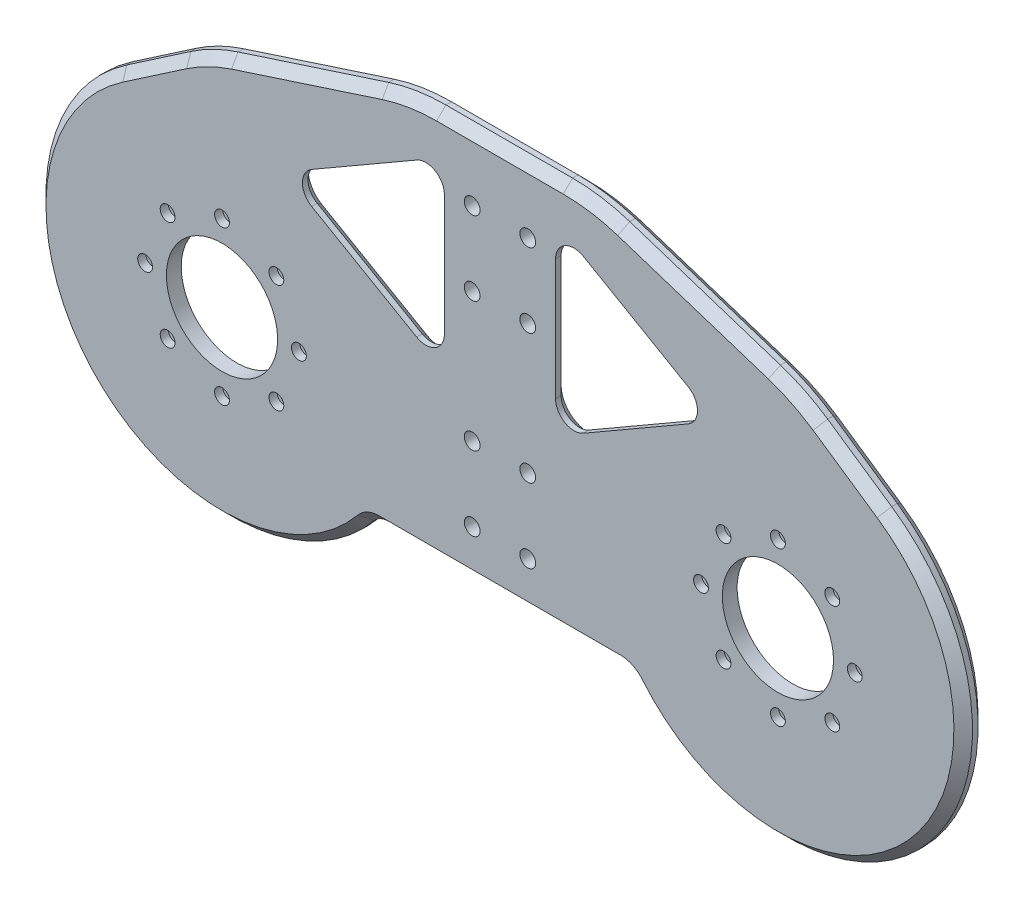
from build123d import *
from build123d.topology import SkipClean

# Parameters (mm, degrees)
SKETCH_1_R               = 30
EXTRUDE_1_DEPTH          = 8
CUT_EXTRUDE_5_DEPTH      = 905.685953271
CUT_EXTRUDE_5_DEPTH_BACK = 905.685953271
SKETCH_8_R               = 2.25
SKETCH_9_R               = 4
CUT_EXTRUDE_6_DEPTH      = 4.4
FILLET_1_R               = 100
CUT_EXTRUDE_7_DEPTH      = 83
CUT_EXTRUDE_8_DEPTH      = 83
FILLET_3_R               = 100
FILLET_4_R               = 10
SKETCH_14_R              = 4.25
CUT_EXTRUDE_9_DEPTH      = 83
EXTRUDE_2_DEPTH          = 5
CUT_EXTRUDE_10_DEPTH     = 69
FILLET_5_R               = 10
CHAMFER_1_SIZE           = 5
CHAMFER_2_SIZE           = 5


with BuildPart() as part:
    # 草图1 → 凸台-拉伸1 (new body)
    with BuildSketch(Plane.XY):
        Polygon((0, 250), (769.420884294, 0), (0, 0), (-100, 0), (-869.420884294, 0), (-100, 250), align=None)
        with Locations((100, 100)):
            Circle(SKETCH_1_R, mode=Mode.SUBTRACT)
        with Locations(Location((-200, 100, 0), (0, 0, 180))):
            Circle(SKETCH_1_R, mode=Mode.SUBTRACT)
    extrude(amount=EXTRUDE_1_DEPTH)

    # 草图8 → 切除-拉伸5 (cut, two sides: drawn at the far end of the back side and taken through both)
    with BuildSketch(Plane.XY.offset(8).offset(-CUT_EXTRUDE_5_DEPTH_BACK)):
        with Locations((100, 141.5)):
            Circle(SKETCH_8_R)
        with Locations((129.344931419, 129.344931419)):
            Circle(SKETCH_8_R)
        with Locations((141.5, 100)):
            Circle(SKETCH_8_R)
        with Locations((129.344931419, 70.655068581)):
            Circle(SKETCH_8_R)
        with Locations((100, 58.5)):
            Circle(SKETCH_8_R)
        with Locations((70.655068581, 70.655068581)):
            Circle(SKETCH_8_R)
        with Locations((58.5, 100)):
            Circle(SKETCH_8_R)
        with Locations((70.655068581, 129.344931419)):
            Circle(SKETCH_8_R)
        with Locations(Location((-170.655068581, 129.344931419, 0), (0, 0, 180))):
            Circle(SKETCH_8_R)
        with Locations(Location((-158.5, 100, 0), (0, 0, 180))):
            Circle(SKETCH_8_R)
        with Locations(Location((-170.655068581, 70.655068581, 0), (0, 0, 180))):
            Circle(SKETCH_8_R)
        with Locations(Location((-200, 58.5, 0), (0, 0, 180))):
            Circle(SKETCH_8_R)
        with Locations(Location((-229.344931419, 70.655068581, 0), (0, 0, 180))):
            Circle(SKETCH_8_R)
        with Locations(Location((-241.5, 100, 0), (0, 0, 180))):
            Circle(SKETCH_8_R)
        with Locations(Location((-229.344931419, 129.344931419, 0), (0, 0, 180))):
            Circle(SKETCH_8_R)
        with Locations(Location((-200, 141.5, 0), (0, 0, 180))):
            Circle(SKETCH_8_R)
    extrude(amount=CUT_EXTRUDE_5_DEPTH + CUT_EXTRUDE_5_DEPTH_BACK, mode=Mode.SUBTRACT)

    # 草图9 → 切除-拉伸6 (cut)
    with BuildSketch(Plane.XY.offset(8)):
        with Locations((-200, 141.5)):
            Circle(SKETCH_9_R)
        with Locations((-170.655068581, 129.344931419)):
            Circle(SKETCH_9_R)
        with Locations((-158.5, 100)):
            Circle(SKETCH_9_R)
        with Locations((-170.655068581, 70.655068581)):
            Circle(SKETCH_9_R)
        with Locations((-200, 58.5)):
            Circle(SKETCH_9_R)
        with Locations((-229.344931419, 70.655068581)):
            Circle(SKETCH_9_R)
        with Locations((-241.5, 100)):
            Circle(SKETCH_9_R)
        with Locations((-229.344931419, 129.344931419)):
            Circle(SKETCH_9_R)
        with Locations(Location((129.344931419, 129.344931419, 0), (0, 0, 180))):
            Circle(SKETCH_9_R)
        with Locations(Location((141.5, 100, 0), (0, 0, 180))):
            Circle(SKETCH_9_R)
        with Locations(Location((129.344931419, 70.655068581, 0), (0, 0, 180))):
            Circle(SKETCH_9_R)
        with Locations(Location((100, 58.5, 0), (0, 0, 180))):
            Circle(SKETCH_9_R)
        with Locations(Location((70.655068581, 70.655068581, 0), (0, 0, 180))):
            Circle(SKETCH_9_R)
        with Locations(Location((58.5, 100, 0), (0, 0, 180))):
            Circle(SKETCH_9_R)
        with Locations(Location((70.655068581, 129.344931419, 0), (0, 0, 180))):
            Circle(SKETCH_9_R)
        with Locations(Location((100, 141.5, 0), (0, 0, 180))):
            Circle(SKETCH_9_R)
    extrude(amount=-CUT_EXTRUDE_6_DEPTH, mode=Mode.SUBTRACT)

    # 圆角1
    fillet_1_edges = [part.edges().sort_by_distance(p)[0] for p in [
        (-869.420884294, 0, 4),
        (769.420884294, 0, 4),
    ]]
    fillet(fillet_1_edges, radius=FILLET_1_R)

    # 草图12 → 切除-拉伸7 (cut)
    with BuildSketch(Plane(origin=(0, 0, 0), x_dir=(-1, 0, 0), z_dir=(0, 0, -1))):
        with BuildLine():
            Line((-20, 40), (120, 40))
            ThreePointArc((120, 40), (155.27864045, 10.5572809), (200, 0))
            Line((200, 0), (-100, 0))
            ThreePointArc((-100, 0), (-55.27864045, 10.5572809), (-20, 40))
        make_face()
    extrude(amount=-CUT_EXTRUDE_7_DEPTH, mode=Mode.SUBTRACT)

    # 草图13 → 切除-拉伸8 (cut)
    with BuildSketch(Plane.XY.offset(8)):
        with BuildLine():
            Line((-238.045732826, 0), (-200, 0))
            ThreePointArc((-200, 0), (-295.54722537, 70.491904093), (-256.388333797, 182.585445519))
            Line((-256.388333797, 182.585445519), (-210, 214.258833414))
            Line((-210, 214.258833414), (-268.947432264, 195.10565163))
            ThreePointArc((-268.947432264, 195.10565163), (-336.814566886, 84.356553496), (-238.045732826, 0))
        make_face()
        with BuildLine():
            Line((110, 214.258833414), (168.947432264, 195.10565163))
            ThreePointArc((168.947432264, 195.10565163), (236.814566886, 84.356553496), (138.045732826, 0))
            Line((138.045732826, 0), (100, 0))
            ThreePointArc((100, 0), (195.54722537, 70.491904093), (156.388333797, 182.585445519))
            Line((156.388333797, 182.585445519), (110, 214.258833414))
        make_face()
    extrude(amount=-CUT_EXTRUDE_8_DEPTH, mode=Mode.SUBTRACT)

    # 圆角3
    fillet_3_edges = [part.edges().sort_by_distance(p)[0] for p in [
        (-100, 250, 4),
        (0, 250, 4),
        (-210, 214.258833414, 4),
        (110, 214.258833414, 4),
    ]]
    fillet(fillet_3_edges, radius=FILLET_3_R)

    # 圆角4
    fillet_4_edges = [part.edges().sort_by_distance(p)[0] for p in [
        (20, 40, 4),
        (-120, 40, 4),
    ]]
    fillet(fillet_4_edges, radius=FILLET_4_R)

    # 草图14 → 切除-拉伸9 (cut)
    with BuildSketch(Plane.XY.offset(8)):
        with Locations((-35, 65)):
            Circle(SKETCH_14_R)
        with Locations((-35, 105)):
            Circle(SKETCH_14_R)
        with Locations((-35, 175)):
            Circle(SKETCH_14_R)
        with Locations((-35, 215)):
            Circle(SKETCH_14_R)
        with Locations(Location((-65, 215, 0), (0, 0, 180))):
            Circle(SKETCH_14_R)
        with Locations(Location((-65, 175, 0), (0, 0, 180))):
            Circle(SKETCH_14_R)
        with Locations(Location((-65, 105, 0), (0, 0, 180))):
            Circle(SKETCH_14_R)
        with Locations(Location((-65, 65, 0), (0, 0, 180))):
            Circle(SKETCH_14_R)
    extrude(amount=-CUT_EXTRUDE_9_DEPTH, mode=Mode.SUBTRACT)

    # 草图15 → 凸台-拉伸2 (add)
    with SkipClean():  # the faces are left unmerged after this step: merging them gives an invalid solid
        with BuildSketch(Plane(origin=(0, 0, 0), x_dir=(-1, 0, 0), z_dir=(0, 0, -1))):
            with BuildLine():
                Line((-15.063255405, 245.10565163), (-96.358782137, 218.691133779))
                ThreePointArc((-96.358782137, 218.691133779), (-109.548764066, 213.340279426), (-121.845416496, 206.170927668))
                Line((-121.845416496, 206.170927668), (-156.388333797, 182.585445519))
                ThreePointArc((-156.388333797, 182.585445519), (-173.843422805, 32.567449192), (-22.861078416, 36.363636364))
                ThreePointArc((-22.861078416, 36.363636364), (-19.411200585, 39.045340337), (-15.147186258, 40))
                Line((-15.147186258, 40), (115.147186258, 40))
                ThreePointArc((115.147186258, 40), (119.411200585, 39.045340337), (122.861078416, 36.363636364))
                ThreePointArc((122.861078416, 36.363636364), (273.843422805, 32.567449192), (256.388333797, 182.585445519))
                Line((256.388333797, 182.585445519), (221.845416496, 206.170927668))
                ThreePointArc((221.845416496, 206.170927668), (209.548764066, 213.340279426), (196.358782137, 218.691133779))
                Line((196.358782137, 218.691133779), (115.063255405, 245.10565163))
                ThreePointArc((115.063255405, 245.10565163), (99.805002472, 248.76883406), (84.161555968, 250))
                Line((84.161555968, 250), (15.838444032, 250))
                ThreePointArc((15.838444032, 250), (0.194997528, 248.76883406), (-15.063255405, 245.10565163))
            make_face()
            with BuildLine():
                Line((55, 50), (128.192966918, 50))
                ThreePointArc((128.192966918, 50), (262.154722909, 38.412335488), (249.339792072, 172.262264829))
                Line((249.339792072, 172.262264829), (197.086815625, 207.939959117))
                Line((197.086815625, 207.939959117), (98.416155597, 240))
                Line((98.416155597, 240), (55, 240))
                Line((55, 240), (55, 50))
            make_face(mode=Mode.SUBTRACT)
            with BuildLine():
                Line((45, 240), (45, 50))
                Line((45, 50), (-28.192966918, 50))
                ThreePointArc((-28.192966918, 50), (-162.154722909, 38.412335488), (-149.339792072, 172.262264829))
                Line((-149.339792072, 172.262264829), (-97.086815625, 207.939959117))
                Line((-97.086815625, 207.939959117), (1.583844403, 240))
                Line((1.583844403, 240), (45, 240))
            make_face(mode=Mode.SUBTRACT)
        extrude(amount=EXTRUDE_2_DEPTH)

    # 草图16 → 切除-拉伸10 (cut)
    with SkipClean():  # the faces are left unmerged after this step: merging them gives an invalid solid
        with BuildSketch(Plane(origin=(0, 0, 0), x_dir=(-1, 0, 0), z_dir=(0, 0, -1))):
            Polygon((80, 230), (80, 130), (166.602540378, 180), align=None)
            Polygon((-66.602540378, 180), (20, 230), (20, 130), align=None)
        extrude(amount=-CUT_EXTRUDE_10_DEPTH, mode=Mode.SUBTRACT)

    # 圆角5
    fillet_5_edges = [part.edges().sort_by_distance(p)[0] for p in [
        (-197.086815625, 207.939959117, -2.5),
        (-98.416155597, 240, -2.5),
        (-55, 240, -2.5),
        (-55, 50, -2.5),
        (-128.192966918, 50, -2.5),
        (28.192966918, 50, -2.5),
        (-45, 50, -2.5),
        (-45, 240, -2.5),
        (-1.583844403, 240, -2.5),
        (97.086815625, 207.939959117, -2.5),
        (-80, 230, 4),
        (-166.602540378, 180, 4),
        (-80, 130, 4),
        (-20, 130, 4),
        (66.602540378, 180, 4),
        (-20, 230, 4),
    ]]
    fillet(fillet_5_edges, radius=FILLET_5_R)

    # 倒角1
    chamfer_1_edges = [part.edges().sort_by_distance(p)[0] for p in [
        (-273.843422805, 32.567449192, 8),
        (-239.116875146, 194.378186594, 8),
        (139.116875146, 194.378186594, 8),
        (-155.711018771, 231.898392704, 8),
        (55.711018771, 231.898392704, 8),
        (-50, 250, 8),
        (-209.548764066, 213.340279426, 8),
        (-99.805002472, 248.76883406, 8),
        (-0.194997528, 248.76883406, 8),
        (109.548764066, 213.340279426, 8),
        (173.843422805, 32.567449192, 8),
        (-50, 40, 8),
        (19.411200585, 39.045340337, 8),
        (-119.411200585, 39.045340337, 8),
        (-0.194997528, 248.76883406, -5),
        (55.711018771, 231.898392704, -5),
        (109.548764066, 213.340279426, -5),
        (139.116875146, 194.378186594, -5),
        (173.843422805, 32.567449192, -5),
        (19.411200585, 39.045340337, -5),
        (-50, 40, -5),
        (-119.411200585, 39.045340337, -5),
        (-273.843422805, 32.567449192, -5),
        (-239.116875146, 194.378186594, -5),
        (-209.548764066, 213.340279426, -5),
        (-155.711018771, 231.898392704, -5),
        (-99.805002472, 248.76883406, -5),
        (-50, 250, -5),
    ]]
    chamfer(chamfer_1_edges, length=CHAMFER_1_SIZE - 0.0001)  # a hair under: the kernel refuses the full size

    # 倒角2
    chamfer_2_edges = [part.edges().sort_by_distance(p)[0] for p in [
        (23.301270189, 155, 0),
        (23.301270189, 205, 0),
        (-20, 180, 0),
        (-123.301270189, 205, 0),
        (-123.301270189, 155, 0),
        (-80, 180, 0),
        (-156.602540378, 180, 0),
        (-85, 138.660254038, 0),
        (-85, 221.339745962, 0),
        (-15, 221.339745962, 0),
        (56.602540378, 180, 0),
        (-15, 138.660254038, 0),
    ]]
    chamfer(chamfer_2_edges, length=CHAMFER_2_SIZE)


solid = part.part
